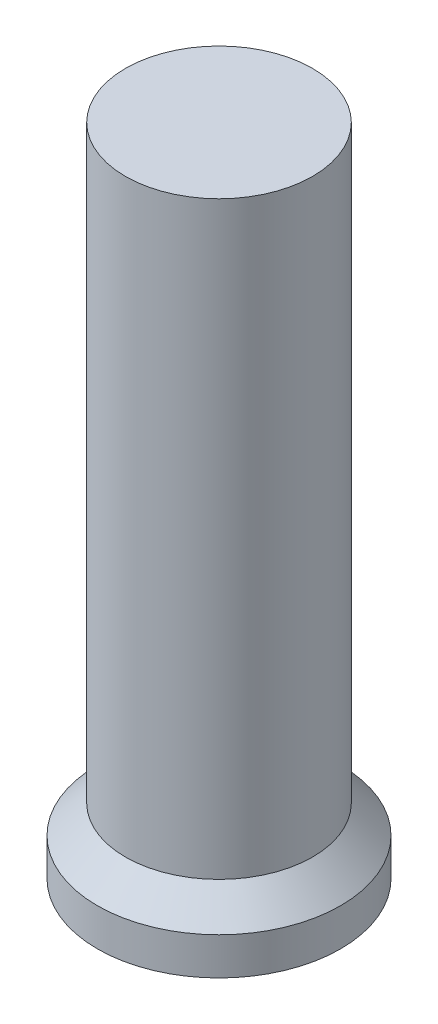
from build123d import *

# Parameters (mm, degrees)
SKETCH_1_R          = 6.5
EXTRUDE_1_DEPTH     = 35
CUT_EXTRUDE_START   = -30
SKETCH_2_R          = 6.5
SKETCH_2_R_2        = 5
CUT_EXTRUDE_1_DEPTH = 30
CHAMFER_1_SIZE      = 3


with BuildPart() as part:
    # Эскиз1 → Бобышка-Вытянуть1 (new body)
    with BuildSketch(Plane(origin=(0, 0, 0), x_dir=(1, 0, 0), z_dir=(0, 1, 0))):
        with Locations(Location((0, 0, 0), (0, 0, 270))):
            Circle(SKETCH_1_R)
    extrude(amount=EXTRUDE_1_DEPTH)

    # Эскиз2 → Вырез-Вытянуть1 (cut)
    with BuildSketch(Plane(origin=(0, 35, 0), x_dir=(1, 0, 0), z_dir=(0, 1, 0)).offset(CUT_EXTRUDE_START)):
        with Locations(Location((0, 0, 0), (0, 0, 270))):
            Circle(SKETCH_2_R)
        with Locations(Location((0, 0, 0), (0, 0, 270))):
            Circle(SKETCH_2_R_2, mode=Mode.SUBTRACT)
    extrude(amount=CUT_EXTRUDE_1_DEPTH, mode=Mode.SUBTRACT)

    # Фаска1
    # the kernel refuses this chamfer: 3 mm, written as the material it takes off along each edge
    with BuildSketch(Plane(origin=(0, 5, 0), x_dir=(0, 0, 1), z_dir=(-1, 0, 0))) as chamfer_1_piece_1_section:
        Polygon((6.5, -CHAMFER_1_SIZE), (6.5 - CHAMFER_1_SIZE, 0), (6.5, 0), align=None)
    chamfer_1_piece_1 = revolve(axis=Axis((0, 5, 0), (0, 1, 0)), mode=Mode.PRIVATE)
    chamfer_1_piece_1 = chamfer_1_piece_1 - Plane(origin=(0, 2.743926997, 0), x_dir=(0, 0, 1), z_dir=(0, -1, 0)) * Cylinder(5, 27, mode=Mode.PRIVATE)
    add(chamfer_1_piece_1, mode=Mode.SUBTRACT)


solid = part.part
